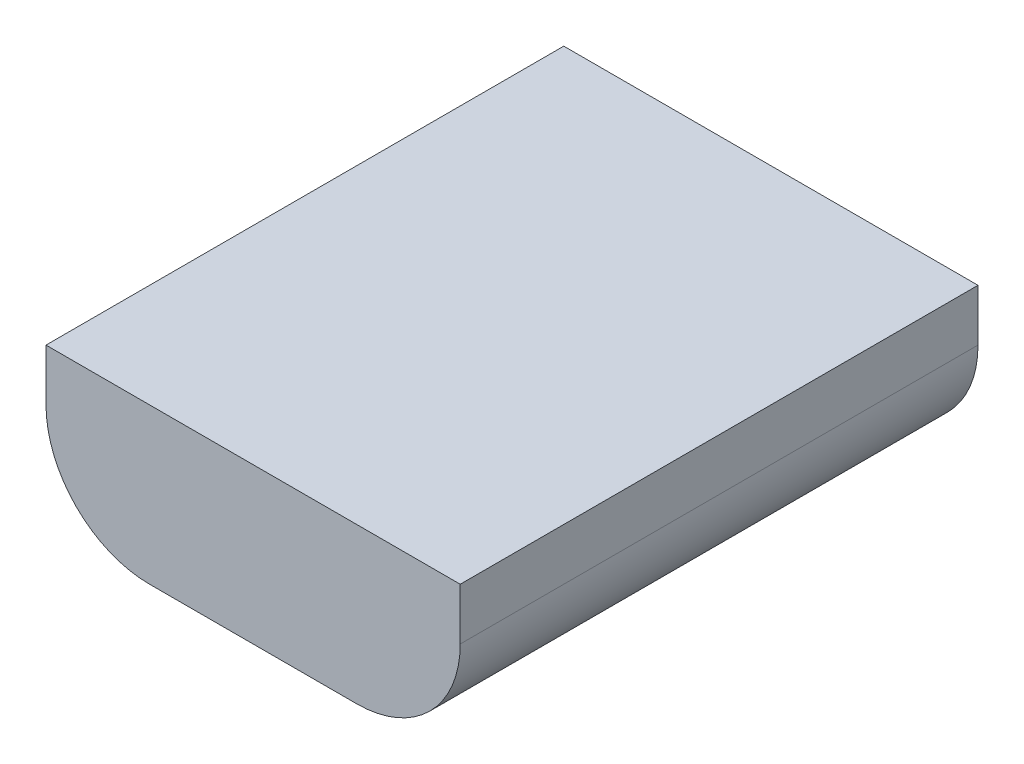
from build123d import *

# Parameters (mm, degrees)
BOSS_EXTRUDE1_DEPTH = 100


with BuildPart() as part:
    # Sketch1 → Boss-Extrude1 (new body)
    with BuildSketch(Plane.XY):
        with BuildLine():
            Line((-20, 0), (20, 0))
            ThreePointArc((20, 0), (34.142135624, 5.857864376), (40, 20))
            Line((40, 20), (40, 30))
            Line((40, 30), (-40, 30))
            Line((-40, 30), (-40, 20))
            ThreePointArc((-40, 20), (-34.142135624, 5.857864376), (-20, 0))
        make_face()
    extrude(amount=BOSS_EXTRUDE1_DEPTH)


solid = part.part
